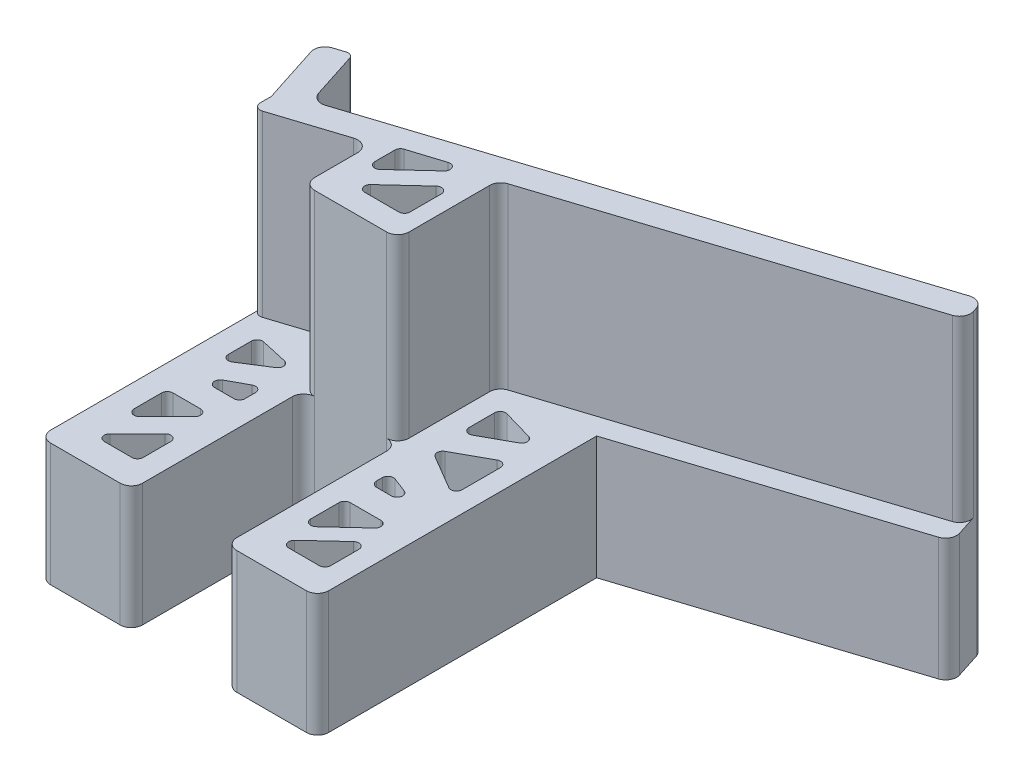
from build123d import *

# Parameters (mm, degrees)
BOSS_EXTRUDE1_DEPTH = 22
BOSS_EXTRUDE2_DEPTH = 32
SKETCH3_W           = 23.945371254
SKETCH3_H           = 71.923159481
CUT_EXTRUDE1_DEPTH  = 30
FILLET2_R           = 2
BOSS_EXTRUDE3_DEPTH = 54
FILLET6_R           = 2
CUT_EXTRUDE3_DEPTH  = 52
FILLET7_R           = 1
FILLET8_R           = 1
CUT_EXTRUDE4_DEPTH  = 92
FILLET9_R           = 1
FILLET10_R          = 1
FILLET11_R          = 2
FILLET12_R          = 2


with BuildPart() as part:
    # Sketch1 → Boss-Extrude1 (new body)
    with BuildSketch(Plane(origin=(0, 0, 0), x_dir=(1, 0, 0), z_dir=(0, 1, 0))):
        Polygon((-37.076635514, -9.668691589), (-37.076635514, -40.512616822), (-20.61588785, -40.512616822), (-20.61588785, -9.668691589), (-3.71588785, -9.668691589), (-3.71588785, -40.512616822), (12.744859813, -40.512616822), (12.744859813, 9.487383178), (89.501702283, 34.216575103), (86.85982051, 42.416701646), (-37.076635514, 2.487383178), align=None)
    extrude(amount=BOSS_EXTRUDE1_DEPTH)

    # Sketch2 → Boss-Extrude2 (add)
    with BuildSketch(Plane(origin=(0, 22, 0), x_dir=(1, 0, 0), z_dir=(0, 1, 0))):
        with BuildLine():
            ThreePointArc((-37.076635514, -0.984119735), (-36.616723793, -1.888134676), (-35.615229622, -2.048668876))
            Line((-35.615229622, -2.048668876), (-20.61588785, 2.783755042))
            Line((-20.61588785, 2.783755042), (-20.61588785, -9.668691589))
            Line((-20.61588785, -9.668691589), (-3.71588785, -9.668691589))
            Line((-3.71588785, -9.668691589), (-3.71588785, 8.228524917))
            Line((-3.71588785, 8.228524917), (88.321226402, 37.880649592))
            Line((88.321226402, 37.880649592), (86.85982051, 42.416701646))
            Line((86.85982051, 42.416701646), (-37.076635514, 2.487383178))
            Line((-37.076635514, 2.487383178), (-37.076635514, -0.984119735))
        make_face()
    extrude(amount=BOSS_EXTRUDE2_DEPTH)

    # Sketch3 → Cut-Extrude1 (cut)
    with BuildSketch(Plane(origin=(91.072392827, 0, -29.341314844), x_dir=(-0.3066536792294104, 0, -0.9518211602055641), z_dir=(0.9518211602055641, 0, -0.3066536792294104))):
        with Locations((10.504374449, 29.474844973)):
            Rectangle(SKETCH3_W, SKETCH3_H)
    extrude(amount=-CUT_EXTRUDE1_DEPTH, mode=Mode.SUBTRACT)

    # Fillet2
    fillet2_edges = [part.edges().sort_by_distance(p)[0] for p in [
        (58.305185704, 27, -33.217091269),
        (59.766591596, 38, -28.681039215),
        (60.947067477, 11, -25.016964726),
        (-20.61588785, 11, 9.668691589),
        (-3.71588785, 11, 9.668691589),
        (12.744859813, 11, 40.512616822),
        (-3.71588785, 11, 40.512616822),
        (-20.61588785, 11, 40.512616822),
        (-37.076635514, 11, 40.512616822),
        (-37.076635514, 27, -2.487383178),
    ]]
    fillet(fillet2_edges, radius=FILLET2_R)

    # Sketch4 → Boss-Extrude3 (add)
    with BuildSketch(Plane.XZ):
        Polygon((-37.076635514, -1.030499574), (-41.063133344, -13.404174657), (-36.304027543, -14.937443053), (-32.742764113, -3.883651369), align=None)
    extrude(amount=-BOSS_EXTRUDE3_DEPTH)

    # Fillet6
    fillet6_edges = [part.edges().sort_by_distance(p)[0] for p in [
        (-3.71588785, 38, -8.228524917),
        (-20.61588785, 38, -2.783755042),
        (-3.71588785, 38, 9.668691589),
        (-20.61588785, 38, 9.668691589),
    ]]
    fillet(fillet6_edges, radius=FILLET6_R)

    # Sketch7 → Cut-Extrude3 (cut)
    with BuildSketch(Plane(origin=(0, 22, 0), x_dir=(1, 0, 0), z_dir=(0, 1, 0))):
        Polygon((-24.54212456, -35.469861986), (-32.908386441, -35.469861986), (-24.54212456, -27.103600105), align=None)
        Polygon((-24.54212456, -21.779615272), (-32.908386441, -30.145877153), (-32.908386441, -21.779615272), align=None)
        Polygon((-24.54212456, -17.2161997), (-32.908386441, -17.2161997), (-24.54212456, -12.652784128), align=None)
        Polygon((-32.908386441, -12.652784128), (-24.54212456, -7.328799295), (-32.908386441, -5.469629988), align=None)
        Polygon((0, -35.469861986), (9.031575717, -35.469861986), (9.031575717, -27.103600105), align=None)
        Polygon((0, -31.286731046), (9.031575717, -22.920469165), (0, -22.920469165), align=None)
        Polygon((0, -18.194074465), (9.031575717, -18.194074465), (0, -14.717186411), align=None)
        Polygon((0, -7.328799295), (9.031575717, -12.652784128), (9.031575717, -2.330236462), align=None)
        Polygon((0, -2.330236462), (9.031575717, 2.668326371), (0, 5.264484712), align=None)
    extrude(amount=-CUT_EXTRUDE3_DEPTH, mode=Mode.SUBTRACT)

    # Fillet7
    fillet7_edges = [part.edges().sort_by_distance(p)[0] for p in [
        (-24.54212456, 11, 35.469861986),
        (-32.908386441, 11, 35.469861986),
        (-24.54212456, 11, 27.103600105),
        (-32.908386441, 11, 30.145877153),
        (-24.54212456, 11, 21.779615272),
        (-32.908386441, 11, 21.779615272),
        (-24.54212456, 11, 17.2161997),
        (-32.908386441, 11, 17.2161997),
        (-24.54212456, 11, 12.652784128),
        (-32.908386441, 11, 12.652784128),
        (-24.54212456, 11, 7.328799295),
        (-32.908386441, 11, 5.469629988),
    ]]
    fillet(fillet7_edges, radius=FILLET7_R)

    # Fillet8
    fillet8_edges = [part.edges().sort_by_distance(p)[0] for p in [
        (0, 11, 7.328799295),
        (9.031575717, 11, -2.668326371),
        (0, 11, -5.264484712),
        (0, 11, 2.330236462),
        (9.031575717, 11, 2.330236462),
        (9.031575717, 11, 12.652784128),
        (9.031575717, 11, 18.194074465),
        (0, 11, 14.717186411),
        (0, 11, 18.194074465),
        (9.031575717, 11, 22.920469165),
        (0, 11, 22.920469165),
        (0, 11, 31.286731046),
        (9.031575717, 11, 27.103600105),
        (9.031575717, 11, 35.469861986),
        (0, 11, 35.469861986),
    ]]
    fillet(fillet8_edges, radius=FILLET8_R)

    # Sketch8 → Cut-Extrude4 (cut)
    with BuildSketch(Plane.XZ):
        Polygon((-17.697001202, 2.113467213), (-17.697001202, -4.514350641), (-6.72307328, -7.991238695), align=None)
        Polygon((-16.393168182, 5.481702516), (-6.72307328, -3.422444275), (-6.72307328, 5.481702516), align=None)
    extrude(amount=-CUT_EXTRUDE4_DEPTH, mode=Mode.SUBTRACT)

    # Fillet9
    fillet9_edges = [part.edges().sort_by_distance(p)[0] for p in [
        (-6.72307328, 27, 5.481702516),
        (-16.393168182, 27, 5.481702516),
        (-6.72307328, 27, -3.422444275),
        (-6.72307328, 27, -7.991238695),
        (-17.697001202, 27, -4.514350641),
        (-17.697001202, 27, 2.113467213),
    ]]
    fillet(fillet9_edges, radius=FILLET9_R)

    # Fillet10
    fillet10_edges = [part.edges().sort_by_distance(p)[0] for p in [
        (-36.304027543, 27, -14.937443053),
    ]]
    fillet(fillet10_edges, radius=FILLET10_R)

    # Fillet11
    fillet11_edges = [part.edges().sort_by_distance(p)[0] for p in [
        (-41.063133344, 27, -13.404174657),
    ]]
    fillet(fillet11_edges, radius=FILLET11_R)

    # Fillet12
    fillet12_edges = [part.edges().sort_by_distance(p)[0] for p in [
        (-32.742764113, 27, -3.883651369),
    ]]
    fillet(fillet12_edges, radius=FILLET12_R)


solid = part.part
